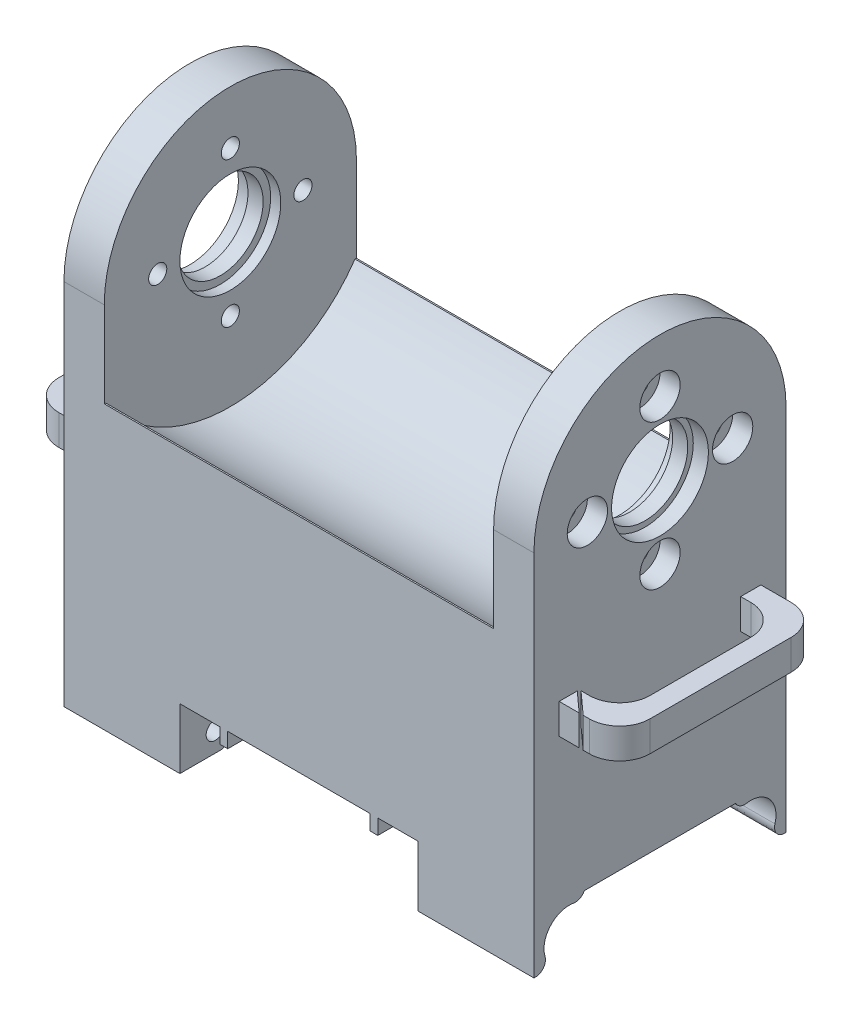
from build123d import *

# Parameters (mm, degrees)
BOSS_EXTRUDE1_DEPTH = 4
SKETCH3_W           = 25
SKETCH3_H           = 22
BOSS_EXTRUDE2_DEPTH = 19.3
FILLET1_RADIUS      = 12.5
FILLET1_LENGTH      = 4
CUT_EXTRUDE1_REACH  = 38.232
SKETCH4_R           = 15
CUT_EXTRUDE2_REACH  = 40.512
SKETCH5_R           = 4.25
SKETCH6_R           = 4.8
CUT_EXTRUDE3_DEPTH  = 1.5
SKETCH7_R           = 5
CUT_EXTRUDE4_DEPTH  = 1
CUT_EXTRUDE5_REACH  = 40.512
SKETCH8_R           = 0.9
CIRPATTERN1_COUNT   = 4
SKETCH10_R          = 2
CUT_EXTRUDE6_DEPTH  = 2
CIRPATTERN2_COUNT   = 4
CUT_EXTRUDE7_REACH  = 40.512
SKETCH11_R          = 0.9
SKETCH12_R          = 2.5
CUT_EXTRUDE8_DEPTH  = 2.5
SKETCH13_W          = 0.761046754
SKETCH13_H          = 25
BOSS_EXTRUDE3_DEPTH = 1.5
SKETCH14_W          = 20
SKETCH14_H          = 3
BOSS_EXTRUDE4_DEPTH = 6
FILLET4_R           = 3
SKETCH15_W          = 4
SKETCH15_H          = 16
CUT_EXTRUDE9_DEPTH  = 5
FILLET5_R           = 3
CUT_EXTRUDE10_DEPTH = 5
SKETCH17_W          = 7.5
SKETCH17_H          = 25
BOSS_EXTRUDE5_DEPTH = 6
SKETCH18_R          = 2.5
CUT_EXTRUDE11_DEPTH = 7.254329374
SKETCH19_R          = 2.5
CUT_EXTRUDE13_DEPTH = 7.25
SKETCH20_W          = 15
SKETCH20_H          = 5
CUT_EXTRUDE15_DEPTH = 58.464858827
SKETCH21_R          = 0.9
CUT_EXTRUDE16_DEPTH = 58.464858827
FILLET6_START       = -5.754329374
FILLET6_DEPTH       = 10.754329374
FILLET6_START_2     = -44
FILLET6_2_DEPTH     = 11.15
FILLET6_START_3     = -32.85
FILLET6_3_DEPTH     = 27.095670626


with BuildPart() as part:
    # Sketch1 → Boss-Extrude1 (new body)
    with BuildSketch(Plane(origin=(0, 0, 0), x_dir=(0, 0, -1), z_dir=(1, 0, 0))):
        Polygon((-7.5, -16), (7.5, -16), (7.5, -21), (12.5, -21), (12.5, 28), (-12.5, 28), (-12.5, -21), (-7.5, -21), align=None)
    extrude(amount=BOSS_EXTRUDE1_DEPTH)

    # Sketch3 → Boss-Extrude2 (add)
    with BuildSketch(Plane.ZY):
        with Locations((0, -4)):
            Rectangle(SKETCH3_W, SKETCH3_H)
    extrude(amount=BOSS_EXTRUDE2_DEPTH)

    # Fillet1: full round fillet: the end face becomes a half cylinder, R = half its width
    fillet1_face = Plane((2, 28, 0), x_dir=(1, 0, 0), z_dir=(0, 1, 0))  # on the end face: x along it, z out of the body
    fillet1_slab = fillet1_face.offset(-FILLET1_RADIUS / 2) * Box(FILLET1_LENGTH, 2 * FILLET1_RADIUS, FILLET1_RADIUS, mode=Mode.PRIVATE)  # the body's end, R deep
    fillet1_round = Plane((2, 15.5, 0), x_dir=(0, 1, 0), z_dir=(1, 0, 0)) * Cylinder(FILLET1_RADIUS, FILLET1_LENGTH, mode=Mode.PRIVATE)  # its axis R under the face
    add(fillet1_slab - fillet1_round, mode=Mode.SUBTRACT)

    # Sketch4 → Cut-Extrude1 (cut, up to next)
    with BuildSketch(Plane.ZY, mode=Mode.PRIVATE) as cut_extrude1_sk1:
        with Locations((0, 15.5)):
            Circle(SKETCH4_R)
    cut_extrude1_tool1 = extrude(cut_extrude1_sk1.sketch, amount=CUT_EXTRUDE1_REACH, mode=Mode.PRIVATE) & part.part
    add(cut_extrude1_tool1.solids().sort_by_distance((0, 15.5, 0))[0], mode=Mode.SUBTRACT)

    # Sketch5 → Cut-Extrude2 (cut, up to next)
    with BuildSketch(Plane(origin=(4, 0, 0), x_dir=(0, 0, -1), z_dir=(1, 0, 0)), mode=Mode.PRIVATE) as cut_extrude2_sk1:
        with Locations((0, 15.5)):
            Circle(SKETCH5_R)
    cut_extrude2_tool1 = extrude(cut_extrude2_sk1.sketch, amount=-CUT_EXTRUDE2_REACH, mode=Mode.PRIVATE) & part.part
    add(cut_extrude2_tool1.solids().sort_by_distance((4, 15.5, 0))[0], mode=Mode.SUBTRACT)

    # Sketch6 → Cut-Extrude3 (cut)
    with BuildSketch(Plane(origin=(4, 0, 0), x_dir=(0, 0, -1), z_dir=(1, 0, 0))):
        with Locations((0, 15.5)):
            Circle(SKETCH6_R)
    extrude(amount=-CUT_EXTRUDE3_DEPTH, mode=Mode.SUBTRACT)

    # Sketch7 → Cut-Extrude4 (cut)
    with BuildSketch(Plane.ZY):
        with Locations((0, 15.5)):
            Circle(SKETCH7_R)
    extrude(amount=-CUT_EXTRUDE4_DEPTH, mode=Mode.SUBTRACT)

    # Sketch8 → Cut-Extrude5 (cut, up to next)
    with BuildSketch(Plane(origin=(4, 0, 0), x_dir=(0, 0, -1), z_dir=(1, 0, 0)), mode=Mode.PRIVATE) as cut_extrude5_sk1:
        with Locations((0, 22.7)):
            Circle(SKETCH8_R)
    cut_extrude5_tool1 = extrude(cut_extrude5_sk1.sketch, amount=-CUT_EXTRUDE5_REACH, mode=Mode.PRIVATE) & part.part
    cut_extrude5 = cut_extrude5_tool1.solids().sort_by_distance((4, 22.7, 0))[0]
    add(cut_extrude5, mode=Mode.SUBTRACT)

    # CirPattern1: Cut-Extrude5 ×4 about axis
    cirpattern1_axis = Axis((0, 15.5, 0), (1, 0, 0))
    for i in range(1, CIRPATTERN1_COUNT):
        add(cut_extrude5.rotate(cirpattern1_axis, i * 360 / CIRPATTERN1_COUNT), mode=Mode.SUBTRACT)

    # Sketch10 → Cut-Extrude6 (cut)
    with BuildSketch(Plane(origin=(4, 0, 0), x_dir=(0, 0, -1), z_dir=(1, 0, 0))):
        with Locations((0, 22.7)):
            Circle(SKETCH10_R)
    cut_extrude6 = extrude(amount=-CUT_EXTRUDE6_DEPTH, mode=Mode.SUBTRACT)

    # CirPattern2: Cut-Extrude6 ×4 about axis
    cirpattern2_axis = Axis((0, 15.5, 0), (1, 0, 0))
    for i in range(1, CIRPATTERN2_COUNT):
        add(cut_extrude6.rotate(cirpattern2_axis, i * 360 / CIRPATTERN2_COUNT), mode=Mode.SUBTRACT)

    # Sketch11 → Cut-Extrude7 (cut, up to next)
    with BuildSketch(Plane(origin=(4, 0, 0), x_dir=(0, 0, -1), z_dir=(1, 0, 0)), mode=Mode.PRIVATE) as cut_extrude7_sk1:
        with Locations((-9, -19)):
            Circle(SKETCH11_R)
    cut_extrude7_tool1 = extrude(cut_extrude7_sk1.sketch, amount=-CUT_EXTRUDE7_REACH, mode=Mode.PRIVATE) & part.part
    # Sketch11 → Cut-Extrude7 (cut, up to next)
    with BuildSketch(Plane(origin=(4, 0, 0), x_dir=(0, 0, -1), z_dir=(1, 0, 0)), mode=Mode.PRIVATE) as cut_extrude7_sk2:
        with Locations((9, -19)):
            Circle(SKETCH11_R)
    cut_extrude7_tool2 = extrude(cut_extrude7_sk2.sketch, amount=-CUT_EXTRUDE7_REACH, mode=Mode.PRIVATE) & part.part
    add(cut_extrude7_tool1.solids().sort_by_distance((4, -19, 9))[0], mode=Mode.SUBTRACT)
    add(cut_extrude7_tool2.solids().sort_by_distance((4, -19, -9))[0], mode=Mode.SUBTRACT)

    # Sketch12 → Cut-Extrude8 (cut)
    with BuildSketch(Plane(origin=(4, 0, 0), x_dir=(0, 0, -1), z_dir=(1, 0, 0))):
        with Locations((-9, -19)):
            Circle(SKETCH12_R)
        with Locations((9, -19)):
            Circle(SKETCH12_R)
    extrude(amount=-CUT_EXTRUDE8_DEPTH, mode=Mode.SUBTRACT)

    # Sketch13 → Boss-Extrude3 (add)
    with BuildSketch(Plane.XZ.offset(15)):
        with Locations((-11.859587158, 0)):
            Rectangle(SKETCH13_W, SKETCH13_H)
    extrude(amount=BOSS_EXTRUDE3_DEPTH)

    # Sketch14 → Boss-Extrude4 (add)
    with BuildSketch(Plane(origin=(4, 0, 0), x_dir=(0, 0, -1), z_dir=(1, 0, 0))):
        Rectangle(SKETCH14_W, SKETCH14_H)
    extrude(amount=BOSS_EXTRUDE4_DEPTH)

    # Fillet4
    fillet4_edges = [part.edges().sort_by_distance(p)[0] for p in [
        (10, 0, 10),
        (10, 0, -10),
    ]]
    fillet(fillet4_edges, radius=FILLET4_R)

    # Sketch15 → Cut-Extrude9 (cut)
    with BuildSketch(Plane(origin=(0, -1.5, 0), x_dir=(-1, 0, 0), z_dir=(0, -1, 0))):
        with Locations((-6, 0)):
            Rectangle(SKETCH15_W, SKETCH15_H)
    extrude(amount=-CUT_EXTRUDE9_DEPTH, mode=Mode.SUBTRACT)

    # Fillet5
    fillet5_edges = [part.edges().sort_by_distance(p)[0] for p in [
        (8, 0, 8),
        (8, 0, -8),
    ]]
    fillet(fillet5_edges, radius=FILLET5_R)

    # Sketch16 → Cut-Extrude10 (cut)
    with BuildSketch(Plane(origin=(0, -1.5, 0), x_dir=(-1, 0, 0), z_dir=(0, -1, 0))):
        Polygon((-4, -8.205789338), (-5.989175581, -10), (-6.38377714, -10), (-4.166450464, -8), (-4, -8), align=None)
    extrude(amount=-CUT_EXTRUDE10_DEPTH, mode=Mode.SUBTRACT)

    # Mirror1: part across plane


with BuildPart() as part_1:
    add(part.part)
    add(part.part.mirror(Plane(origin=(-19.3, 0, 0), x_dir=(0, 0, 1), z_dir=(1, 0, 0))))

    # Sketch17 → Boss-Extrude5 (add)
    with BuildSketch(Plane.XZ.offset(15)):
        with Locations((-3.75, 0)):
            Rectangle(SKETCH17_W, SKETCH17_H)
        with Locations((-34.85, 0)):
            Rectangle(SKETCH17_W, SKETCH17_H)
    extrude(amount=BOSS_EXTRUDE5_DEPTH)

    # Sketch18 → Cut-Extrude11 (cut)
    with BuildSketch(Plane(origin=(1.5, 0, 0), x_dir=(0, 0, -1), z_dir=(1, 0, 0))):
        with Locations((9, -19)):
            Circle(SKETCH18_R)
        with Locations((-9, -19)):
            Circle(SKETCH18_R)
    extrude(amount=-CUT_EXTRUDE11_DEPTH, mode=Mode.SUBTRACT)

    # Sketch19 → Cut-Extrude13 (cut)
    with BuildSketch(Plane.ZY.offset(40.1)):
        with Locations((9, -19)):
            Circle(SKETCH19_R)
        with Locations((-9, -19)):
            Circle(SKETCH19_R)
    extrude(amount=-CUT_EXTRUDE13_DEPTH, mode=Mode.SUBTRACT)

    # Sketch20 → Cut-Extrude15 (cut, through all)
    with BuildSketch(Plane.ZY.offset(38.6)):
        with Locations((0, -18.5)):
            Rectangle(SKETCH20_W, SKETCH20_H)
    extrude(amount=-CUT_EXTRUDE15_DEPTH, mode=Mode.SUBTRACT)

    # Sketch21 → Cut-Extrude16 (cut, through all)
    with BuildSketch(Plane(origin=(0, 0, 0), x_dir=(0, 0, -1), z_dir=(1, 0, 0))):
        with Locations(Location((-9, -19, 0), (0, 0, 180))):
            Circle(SKETCH21_R)
        with Locations(Location((9, -19, 0), (0, 0, 180))):
            Circle(SKETCH21_R)
    extrude(amount=-CUT_EXTRUDE16_DEPTH, mode=Mode.SUBTRACT)

    # Fillet6: read off the stored shape, not the designer's step
    # Fillet6 outline → Fillet6 (cut)
    with BuildSketch(Plane.YZ.offset(FILLET6_START)):
        with BuildLine():
            Line((-21, -10.5), (-21, -12.354101966))
            add(Edge.make_bspline(
                [(-21, -12.354101966), (-21, -11.01246118), (-19.714285714, -11.395787119)],
                knots=[0, 0, 0, 1, 1, 1], degree=2, weights=[1, 0.597614305, 1]))
            ThreePointArc((-19.714285714, -11.395787119), (-20.429141482, -11.051232465), (-21, -10.5))
        make_face()
        with BuildLine():
            ThreePointArc((-17, -7.5), (-16.705902918, -8.006461586), (-16.537704575, -8.567447994))
            add(Edge.make_bspline(
                [(-16.537704575, -8.567447994), (-16.666666667, -7.833333333), (-16, -7.5)],
                knots=[0, 0, 0, 1, 1, 1], degree=2, weights=[1, 0.801783726, 1]))
            Line((-16, -7.5), (-17, -7.5))
        make_face()
        with BuildLine():
            ThreePointArc((-21, 10.5), (-20.429141482, 11.051232465), (-19.714285714, 11.395787119))
            add(Edge.make_bspline(
                [(-19.714285714, 11.395787119), (-21, 11.01246118), (-21, 12.354101966)],
                knots=[0, 0, 0, 1, 1, 1], degree=2, weights=[1, 0.597614305, 1]))
            Line((-21, 12.354101966), (-21, 10.5))
        make_face()
        with BuildLine():
            add(Edge.make_bspline(
                [(-16, 7.5), (-16.666666667, 7.833333333), (-16.537704575, 8.567447994)],
                knots=[0, 0, 0, 1, 1, 1], degree=2, weights=[1, 0.801783726, 1]))
            ThreePointArc((-16.537704575, 8.567447994), (-16.705902918, 8.006461586), (-17, 7.5))
            Line((-17, 7.5), (-16, 7.5))
        make_face()
    extrude(amount=FILLET6_DEPTH, mode=Mode.SUBTRACT)

    # Fillet6 2 outline → Fillet6 2 (cut)
    with BuildSketch(Plane.YZ.offset(FILLET6_START_2)):
        with BuildLine():
            Line((-21, -10.5), (-21, -12.354101966))
            add(Edge.make_bspline(
                [(-21, -12.354101966), (-21, -11.01246118), (-19.714285714, -11.395787119)],
                knots=[0, 0, 0, 1, 1, 1], degree=2, weights=[1, 0.597614305, 1]))
            ThreePointArc((-19.714285714, -11.395787119), (-20.429141482, -11.051232465), (-21, -10.5))
        make_face()
        with BuildLine():
            ThreePointArc((-17, -7.5), (-16.705902918, -8.006461586), (-16.537704575, -8.567447994))
            add(Edge.make_bspline(
                [(-16.537704575, -8.567447994), (-16.666666667, -7.833333333), (-16, -7.5)],
                knots=[0, 0, 0, 1, 1, 1], degree=2, weights=[1, 0.801783726, 1]))
            Line((-16, -7.5), (-17, -7.5))
        make_face()
        with BuildLine():
            ThreePointArc((-21, 10.5), (-20.429141482, 11.051232465), (-19.714285714, 11.395787119))
            add(Edge.make_bspline(
                [(-19.714285714, 11.395787119), (-21, 11.01246118), (-21, 12.354101966)],
                knots=[0, 0, 0, 1, 1, 1], degree=2, weights=[1, 0.597614305, 1]))
            Line((-21, 12.354101966), (-21, 10.5))
        make_face()
        with BuildLine():
            add(Edge.make_bspline(
                [(-16, 7.5), (-16.666666667, 7.833333333), (-16.537704575, 8.567447994)],
                knots=[0, 0, 0, 1, 1, 1], degree=2, weights=[1, 0.801783726, 1]))
            ThreePointArc((-16.537704575, 8.567447994), (-16.705902918, 8.006461586), (-17, 7.5))
            Line((-17, 7.5), (-16, 7.5))
        make_face()
    extrude(amount=FILLET6_2_DEPTH, mode=Mode.SUBTRACT)

    # Fillet6 3 outline → Fillet6 3 (cut)
    with BuildSketch(Plane.YZ.offset(FILLET6_START_3)):
        with BuildLine():
            Line((-21, -7.5), (-21, -8.5))
            add(Edge.make_bspline(
                [(-21, -8.5), (-21, -7.5), (-20, -7.5)],
                knots=[0, 0, 0, 1, 1, 1], degree=2, weights=[1, 0.707106781, 1]))
            Line((-20, -7.5), (-21, -7.5))
        make_face()
        with BuildLine():
            add(Edge.make_bspline(
                [(-20, 7.5), (-21, 7.5), (-21, 8.5)],
                knots=[0, 0, 0, 1, 1, 1], degree=2, weights=[1, 0.707106781, 1]))
            Line((-21, 8.5), (-21, 7.5))
            Line((-21, 7.5), (-20, 7.5))
        make_face()
    extrude(amount=FILLET6_3_DEPTH, mode=Mode.SUBTRACT)


solid = part_1.part
